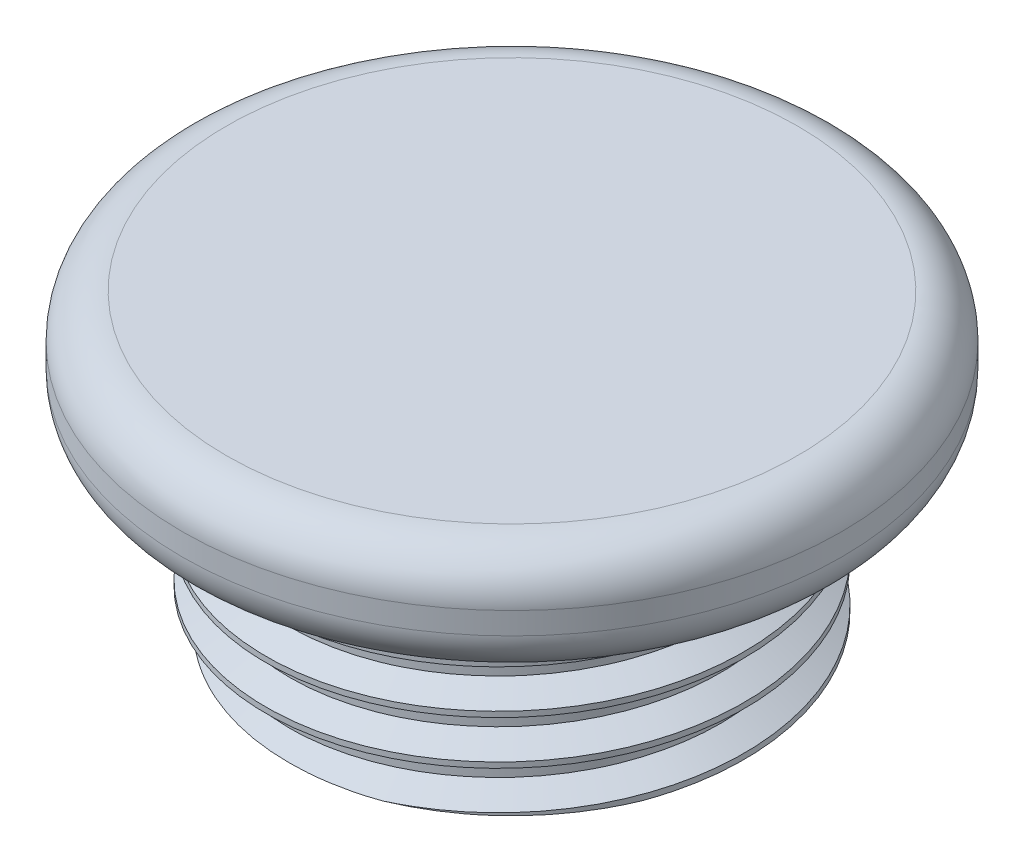
from build123d import *

# Parameters (mm, degrees)
SKETCH1_R           = 4.9
BOSS_EXTRUDE1_DEPTH = 4
THREAD1_PITCH       = 1
THREAD1_TO          = 4
SKETCH5_R           = 7.5
BOSS_EXTRUDE2_DEPTH = 2.5
FILLET1_R           = 1


with BuildPart() as part:
    # Sketch1 → Boss-Extrude1 (new body)
    with BuildSketch(Plane(origin=(0, 0, 0), x_dir=(1, 0, 0), z_dir=(0, 1, 0))):
        with Locations(Location((0, 0, 0), (0, 0, 270))):
            Circle(SKETCH1_R)
    extrude(amount=BOSS_EXTRUDE1_DEPTH)

    # Thread1: arcs per turn and ends read off the stored shape
    # Thread1: the profile of Thread Profile1 profile screwed along a right-hand helix through 4 turns, 8 arcs to a turn; built about Z, then put on its axis
    thread1_z = Axis((0, 0, 0), (0, 0, 1))
    thread1_corners = [(4.8997, 0, -0.000173205), (5.441265875, 0, 0.312499999), (5.441265875, 0, 0.437499999), (4.8997, 0, 0.750173202)]
    with BuildLine(mode=Mode.PRIVATE) as thread1_profile:
        Line(thread1_corners[0], thread1_corners[1])
        Line(thread1_corners[1], thread1_corners[2])
        Line(thread1_corners[2], thread1_corners[3])
        Line(thread1_corners[3], thread1_corners[0])
    thread1_cap = Face(thread1_profile.wire())
    thread1_turn_angles = [0, 22.5, 45, 67.5, 90, 112.5, 135, 157.5, 180, 202.5, 225, 247.5, 270, 292.5, 315, 337.5, 360]
    thread1_turn_weights = [1, 0.9238795325112867, 1, 0.9238795325112867, 1, 0.9238795325112867, 1, 0.9238795325112867, 1, 0.9238795325112867, 1, 0.9238795325112867, 1, 0.9238795325112867, 1, 0.9238795325112867, 1]
    thread1_turn_rails = [Edge.make_bspline([Vector(p[0], p[1], 0).rotate(thread1_z, thread1_turn_angles[k]) / thread1_turn_weights[k] + Vector(0, 0, p[2] + THREAD1_PITCH * thread1_turn_angles[k] / 360) for k in range(17)], [0, 0, 0, 1, 1, 2, 2, 3, 3, 4, 4, 5, 5, 6, 6, 7, 7, 8, 8, 8], 2, thread1_turn_weights) for p in thread1_corners]
    thread1_turn_sides = [Face.make_surface_from_curves(thread1_turn_rails[p[0]], thread1_turn_rails[p[1]]) for p in [(0, 1), (1, 2), (2, 3), (3, 0)]]
    thread1 = Plane(origin=(0, 4, 0), x_dir=(-1, 0, 0), z_dir=(0, -1, 0)) * split(Solid(Shell([*[p.moved(Location((0, 0, THREAD1_PITCH * i))) for i in range(4) for p in thread1_turn_sides], thread1_cap, thread1_cap.rotate(thread1_z, 1440).moved(Location((0, 0, THREAD1_PITCH * 1440 / 360)))])), bisect_by=Plane.XY.offset(THREAD1_TO), keep=Keep.BOTTOM, mode=Mode.PRIVATE)
    add(thread1)

    # Sketch5 → Boss-Extrude2 (add)
    with BuildSketch(Plane(origin=(0, 4, 0), x_dir=(1, 0, 0), z_dir=(0, 1, 0))):
        with Locations(Location((0, 0, 0), (0, 0, 270))):
            Circle(SKETCH5_R)
    extrude(amount=BOSS_EXTRUDE2_DEPTH)

    # Fillet1
    fillet1_edges = [part.edges().sort_by_distance(p)[0] for p in [
        (0, 4, -7.5),
        (0, 6.5, -7.5),
    ]]
    fillet(fillet1_edges, radius=FILLET1_R)


solid = part.part
